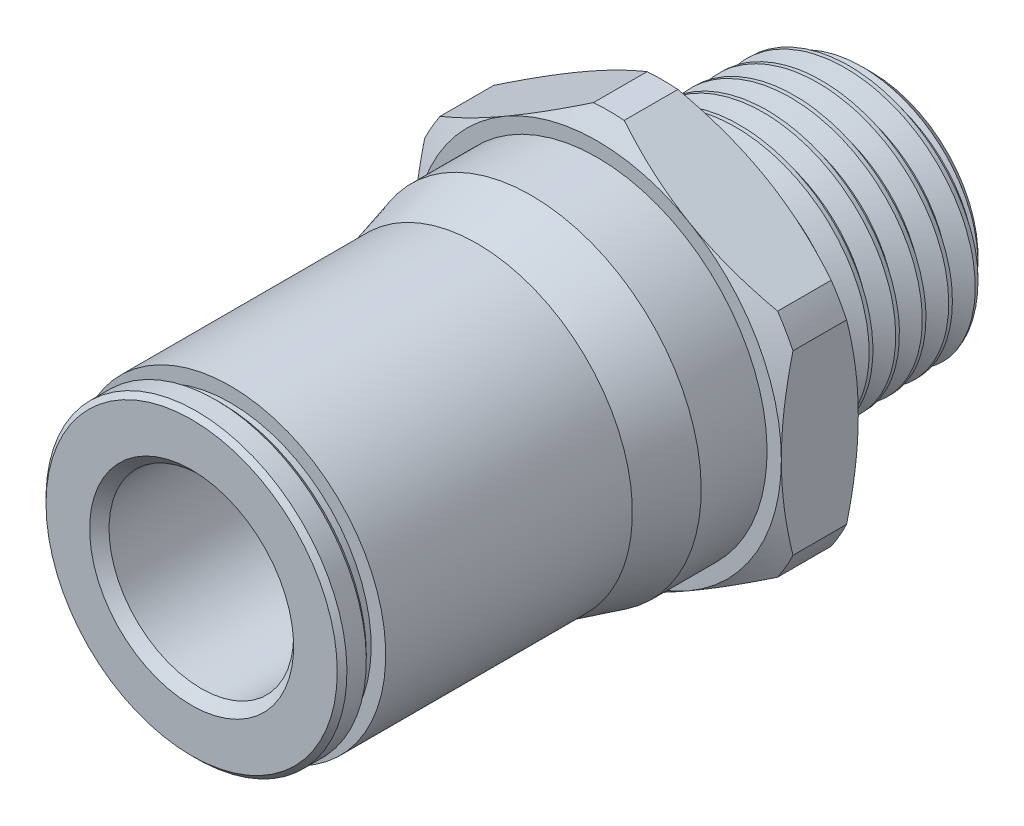
from build123d import *

# Parameters (mm, degrees)
BOSS_EXTRUDE1_START    = 3.37439
BOSS_EXTRUDE1_DEPTH    = 3.96875
SKETCH5_R              = 6.858
BOSS_EXTRUDE2_DEPTH    = 10.20572
BOSS_EXTRUDE2_TAPER    = 1.783333
CUT_SWEEP1_PITCH       = 1.411795
CUT_SWEEP1_HEIGHT      = 11.616831
CUT_SWEEP1_RADIUS      = 6.540244
CUT_SWEEP1_START_ANGLE = 90
SKETCH8_OUTSIDE_W      = 50.438
SKETCH8_OUTSIDE_H      = 52.52
SKETCH8_OUTSIDE_R      = 5.470943
CUT_EXTRUDE1_DEPTH     = 10.20572
CUT_EXTRUDE1_DRAFT     = -45
SKETCH12_R             = 4.7625
CUT_EXTRUDE2_DEPTH     = 22.5806
CUT_EXTRUDE3_DEPTH     = 12.51712


with BuildPart() as part:
    # Sketch2 → Revolve1 (revolve)
    with BuildSketch(Plane(origin=(0, 0, 0), x_dir=(0, 0, -1), z_dir=(1, 0, 0))):
        Polygon((3.37439, 8.763), (-0.02286, 8.763), (-2.821898, 8.013), (-15.54886, 8.013), (-15.54886, 7.263), (-16.04886, 7.263), (-16.04886, 7.513), (-16.29886, 7.763), (-17.29886, 7.763), (-17.54886, 7.513), (-17.54886, 5.2625), (-17.04886, 4.7625), (-17.04886, 0), (3.37439, 0), align=None)
    revolve(axis=Axis((0, 0, -7.34314), (0, 0, 1)))

    # Sketch3 → Boss-Extrude1 (add)
    with BuildSketch(Plane(origin=(0, 0, 0), x_dir=(1, 0, 0), z_dir=(0, 0, -1)).offset(BOSS_EXTRUDE1_START)):
        Polygon((0, 10.969655), (-9.5, 5.484828), (-9.5, -5.484828), (0, -10.969655), (9.5, -5.484828), (9.5, 5.484828), align=None)
    extrude(amount=BOSS_EXTRUDE1_DEPTH)

    # Sketch4 → Cut-Revolve1 (revolve, cut)
    with BuildSketch(Plane(origin=(0, 0, 0), x_dir=(0, 0, -1), z_dir=(1, 0, 0))):
        Polygon((6.742118, -10.541), (3.975412, -10.541), (3.37439, -9.5), (3.37439, -10.969655), (7.34314, -10.969655), (7.34314, -9.5), align=None)
    revolve(axis=Axis((0, 0, -7.34314), (0, 0, 1)), mode=Mode.SUBTRACT)


with BuildPart() as body_2:
    # Sketch5 → Boss-Extrude2 (new body)
    with BuildSketch(Plane(origin=(0, 0, -7.34314), x_dir=(1, 0, 0), z_dir=(0, 0, -1))):
        Circle(SKETCH5_R)
    extrude(amount=BOSS_EXTRUDE2_DEPTH, taper=BOSS_EXTRUDE2_TAPER)

    # Cut-Sweep1: sweep along a helix
    with BuildLine() as cut_sweep1_path:
        # a taper helix: rise per turn along the axis 1.411111, along the cone's slant (build123d's pitch) 1.411795
        add(Helix(CUT_SWEEP1_PITCH, CUT_SWEEP1_HEIGHT, CUT_SWEEP1_RADIUS, center=(0, 0, -17.54886), direction=(0, 0, 1), cone_angle=1.783333, mode=Mode.PRIVATE).rotate(Axis((0, 0, -17.54886), (0, 0, 1)), CUT_SWEEP1_START_ANGLE))
    # Sketch7 → Cut-Sweep1 (sweep, cut)
    with BuildSketch(Plane(origin=(0, 0, 0), x_dir=(0, 0, -1), z_dir=(1, 0, 0))):
        Polygon((18.254416, 5.6237), (18.078027, 5.6237), (17.460666, 6.693001), (18.827679, 6.616623), align=None)
    sweep(path=cut_sweep1_path.line, is_frenet=True, mode=Mode.SUBTRACT)


with BuildPart() as cut_extrude1_tool:
    # Sketch8 outside → Cut-Extrude1 (with draft: the straight prism first)
    with BuildSketch(Plane(origin=(0, 0, -17.54886), x_dir=(1, 0, 0), z_dir=(0, 0, -1))):
        Rectangle(SKETCH8_OUTSIDE_W, SKETCH8_OUTSIDE_H)
        Circle(SKETCH8_OUTSIDE_R, mode=Mode.SUBTRACT)
    extrude(amount=-CUT_EXTRUDE1_DEPTH)
    # Cut-Extrude1: the draft: its side faces are tilted about the plane it starts from
    cut_extrude1_sides = [cut_extrude1_tool.faces().sort_by_distance(p)[0] for p in [
        (0, 26.26, -12.446),
        (25.219, 0, -12.446),
        (0, -26.26, -12.446),
        (-25.219, 0, -12.446),
        (-5.470943, 0, -12.446),
    ]]
    draft(cut_extrude1_sides, Plane(origin=(0, 0, -17.54886), x_dir=(1, 0, 0), z_dir=(0, 0, -1)), CUT_EXTRUDE1_DRAFT)


with BuildPart() as body_2_1:
    add(body_2.part)

    # Cut-Extrude1: cut by cut_extrude1_tool
    add(cut_extrude1_tool.part, mode=Mode.SUBTRACT)


with BuildPart() as part_1:
    add(part.part)

    # Combine1: union body 2
    add(body_2_1.part)

    # Sketch12 → Cut-Extrude2 (cut)
    with BuildSketch(Plane.XY.offset(17.54886)):
        Circle(SKETCH12_R)
    extrude(amount=-CUT_EXTRUDE2_DEPTH, mode=Mode.SUBTRACT)

    # Sketch10 → Cut-Extrude3 (cut)
    with BuildSketch(Plane.XY.offset(-5.03174)):
        Polygon((0, 3.464102), (-3, 1.732051), (-3, -1.732051), (0, -3.464102), (3, -1.732051), (3, 1.732051), align=None)
    extrude(amount=-CUT_EXTRUDE3_DEPTH, mode=Mode.SUBTRACT)

    # Cut-Extrude4 cone 1 section (through the dimple's axis) → Cut-Extrude4 (revolve, cut)
    with BuildSketch(Plane(origin=(0, 0, -17.54886), x_dir=(0, 1, 0), z_dir=(1, 0, 0))):
        Polygon((0, 0), (3.464102, 0), (0, 3.464102), align=None)
    revolve(axis=Axis((0, 0, -17.54886), (0, 0, 1)), mode=Mode.SUBTRACT)


solid = part_1.part
